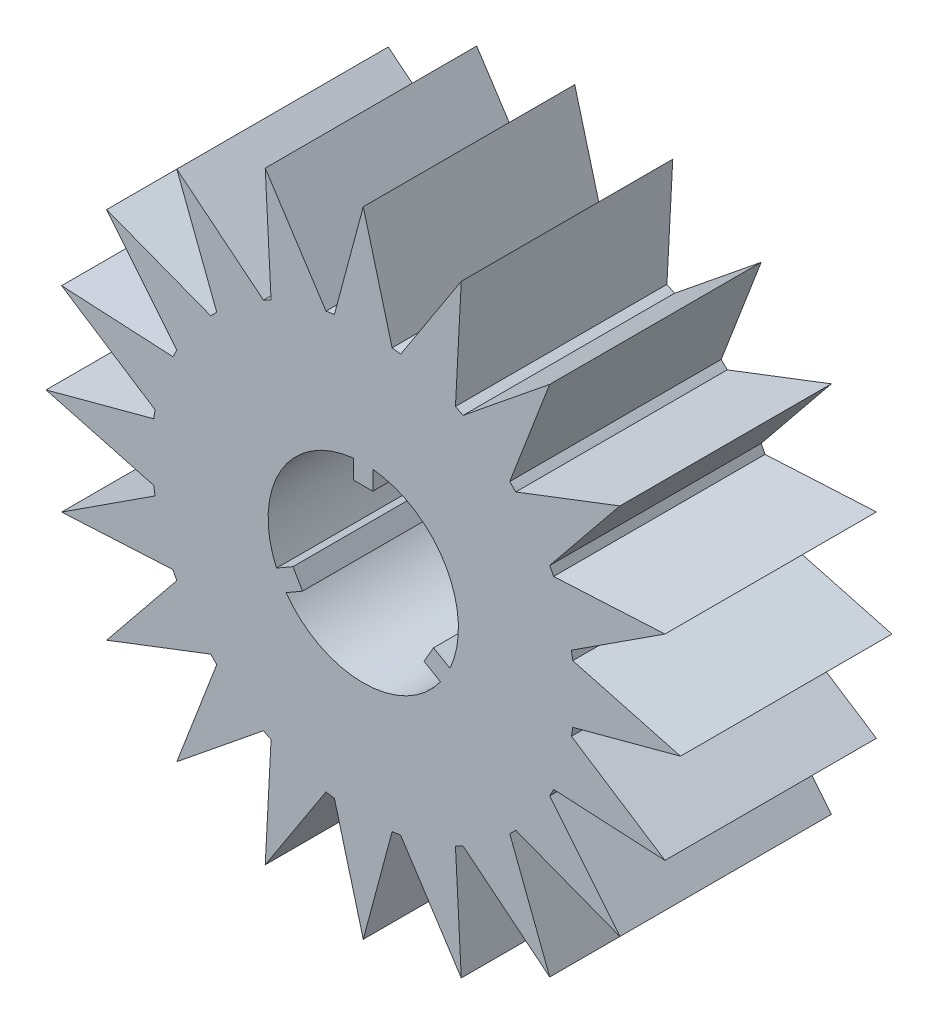
from build123d import *

# Parameters (mm, degrees)
BOSS_EXTRUDE1_DEPTH = 10


with BuildPart() as part:
    # Sketch1 → Boss-Extrude1 (new body)
    with BuildSketch(Plane.XY):
        with BuildLine():
            Line((1.36481914, 9.906425628), (0, 15))
            Line((0, 15), (-1.36481914, 9.906425628))
            ThreePointArc((-1.36481914, 9.906425628), (-1.56434465, 9.876883406), (-1.763233736, 9.843322955))
            Line((-1.763233736, 9.843322955), (-4.635254916, 14.265847744))
            Line((-4.635254916, 14.265847744), (-4.359274009, 8.999818338))
            ThreePointArc((-4.359274009, 8.999818338), (-4.539904997, 8.910065242), (-4.718689009, 8.816687249))
            Line((-4.718689009, 8.816687249), (-8.816778784, 12.135254916))
            Line((-8.816778784, 12.135254916), (-6.927012765, 7.212246124))
            ThreePointArc((-6.927012765, 7.212246124), (-7.071067812, 7.071067812), (-7.212246124, 6.927012765))
            Line((-7.212246124, 6.927012765), (-12.135254916, 8.816778784))
            Line((-12.135254916, 8.816778784), (-8.816687249, 4.718689009))
            ThreePointArc((-8.816687249, 4.718689009), (-8.910065242, 4.539904997), (-8.999818338, 4.359274009))
            Line((-8.999818338, 4.359274009), (-14.265847744, 4.635254916))
            Line((-14.265847744, 4.635254916), (-9.843322955, 1.763233736))
            ThreePointArc((-9.843322955, 1.763233736), (-9.876883406, 1.56434465), (-9.906425628, 1.36481914))
            Line((-9.906425628, 1.36481914), (-15, 0))
            Line((-15, 0), (-9.906425628, -1.36481914))
            ThreePointArc((-9.906425628, -1.36481914), (-9.876883406, -1.56434465), (-9.843322955, -1.763233736))
            Line((-9.843322955, -1.763233736), (-14.265847744, -4.635254916))
            Line((-14.265847744, -4.635254916), (-8.999818338, -4.359274009))
            ThreePointArc((-8.999818338, -4.359274009), (-8.910065242, -4.539904997), (-8.816687249, -4.718689009))
            Line((-8.816687249, -4.718689009), (-12.135254916, -8.816778784))
            Line((-12.135254916, -8.816778784), (-7.212246124, -6.927012765))
            ThreePointArc((-7.212246124, -6.927012765), (-7.071067812, -7.071067812), (-6.927012765, -7.212246124))
            Line((-6.927012765, -7.212246124), (-8.816778784, -12.135254916))
            Line((-8.816778784, -12.135254916), (-4.718689009, -8.816687249))
            ThreePointArc((-4.718689009, -8.816687249), (-4.539904997, -8.910065242), (-4.359274009, -8.999818338))
            Line((-4.359274009, -8.999818338), (-4.635254916, -14.265847744))
            Line((-4.635254916, -14.265847744), (-1.763233736, -9.843322955))
            ThreePointArc((-1.763233736, -9.843322955), (-1.56434465, -9.876883406), (-1.36481914, -9.906425628))
            Line((-1.36481914, -9.906425628), (0, -15))
            Line((0, -15), (1.36481914, -9.906425628))
            ThreePointArc((1.36481914, -9.906425628), (1.56434465, -9.876883406), (1.763233736, -9.843322955))
            Line((1.763233736, -9.843322955), (4.635254916, -14.265847744))
            Line((4.635254916, -14.265847744), (4.359274009, -8.999818338))
            ThreePointArc((4.359274009, -8.999818338), (4.539904997, -8.910065242), (4.718689009, -8.816687249))
            Line((4.718689009, -8.816687249), (8.816778784, -12.135254916))
            Line((8.816778784, -12.135254916), (6.927012765, -7.212246124))
            ThreePointArc((6.927012765, -7.212246124), (7.071067812, -7.071067812), (7.212246124, -6.927012765))
            Line((7.212246124, -6.927012765), (12.135254916, -8.816778784))
            Line((12.135254916, -8.816778784), (8.816687249, -4.718689009))
            ThreePointArc((8.816687249, -4.718689009), (8.910065242, -4.539904997), (8.999818338, -4.359274009))
            Line((8.999818338, -4.359274009), (14.265847744, -4.635254916))
            Line((14.265847744, -4.635254916), (9.843322955, -1.763233736))
            ThreePointArc((9.843322955, -1.763233736), (9.876883406, -1.56434465), (9.906425628, -1.36481914))
            Line((9.906425628, -1.36481914), (15, 0))
            Line((15, 0), (9.906425628, 1.36481914))
            ThreePointArc((9.906425628, 1.36481914), (9.876883406, 1.56434465), (9.843322955, 1.763233736))
            Line((9.843322955, 1.763233736), (14.265847744, 4.635254916))
            Line((14.265847744, 4.635254916), (8.999818338, 4.359274009))
            ThreePointArc((8.999818338, 4.359274009), (8.910065242, 4.539904997), (8.816687249, 4.718689009))
            Line((8.816687249, 4.718689009), (12.135254916, 8.816778784))
            Line((12.135254916, 8.816778784), (7.212246124, 6.927012765))
            ThreePointArc((7.212246124, 6.927012765), (7.071067812, 7.071067812), (6.927012765, 7.212246124))
            Line((6.927012765, 7.212246124), (8.816778784, 12.135254916))
            Line((8.816778784, 12.135254916), (4.718689009, 8.816687249))
            ThreePointArc((4.718689009, 8.816687249), (4.539904997, 8.910065242), (4.359274009, 8.999818338))
            Line((4.359274009, 8.999818338), (4.635254916, 14.265847744))
            Line((4.635254916, 14.265847744), (1.763233736, 9.843322955))
            ThreePointArc((1.763233736, 9.843322955), (1.56434465, 9.876883406), (1.36481914, 9.906425628))
        make_face()
        with BuildLine():
            Line((-0.45, 3.577443467), (0.45, 3.577443467))
            Line((0.45, 3.577443467), (0.45, 4.477443467))
            ThreePointArc((0.45, 4.477443467), (3.897114317, 2.25), (4.102579786, -1.849010302))
            Line((4.102579786, -1.849010302), (3.323156923, -1.399010302))
            Line((3.323156923, -1.399010302), (2.873156923, -2.178433165))
            Line((2.873156923, -2.178433165), (3.652579786, -2.628433165))
            ThreePointArc((3.652579786, -2.628433165), (0, -4.5), (-3.652579786, -2.628433165))
            Line((-3.652579786, -2.628433165), (-2.873156923, -2.178433165))
            Line((-2.873156923, -2.178433165), (-3.323156923, -1.399010302))
            Line((-3.323156923, -1.399010302), (-4.102579786, -1.849010302))
            ThreePointArc((-4.102579786, -1.849010302), (-3.897114317, 2.25), (-0.45, 4.477443467))
            Line((-0.45, 4.477443467), (-0.45, 3.577443467))
        make_face(mode=Mode.SUBTRACT)
    extrude(amount=BOSS_EXTRUDE1_DEPTH)


solid = part.part
